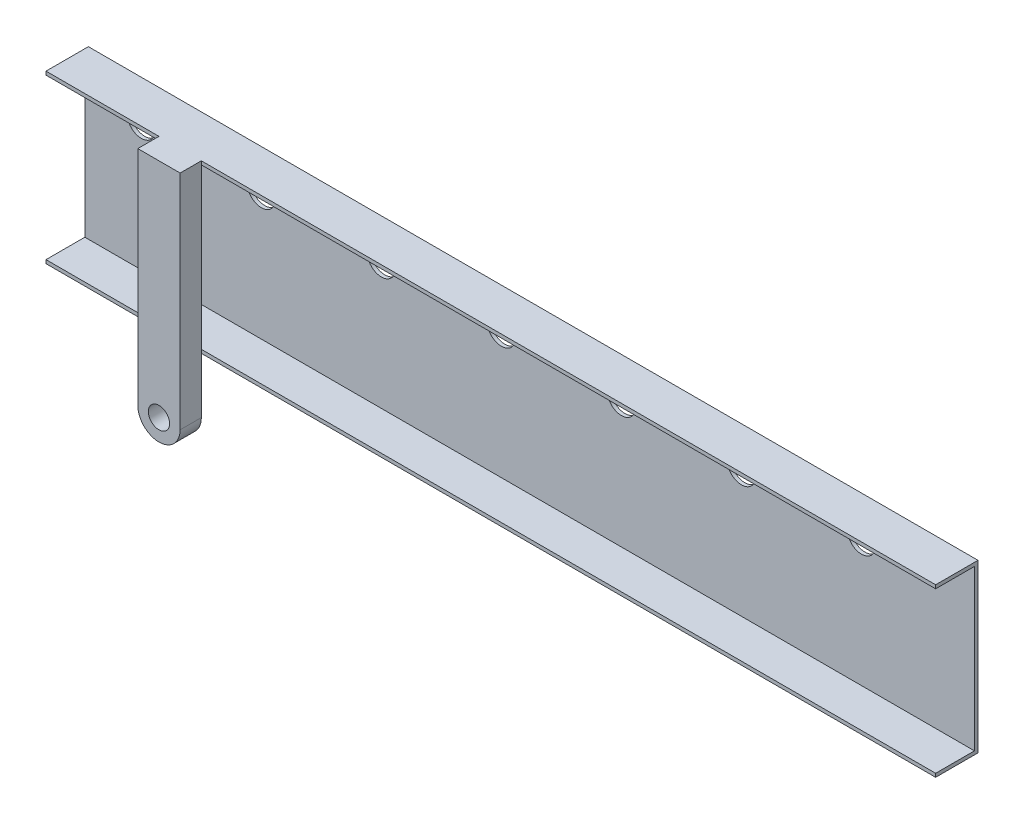
from build123d import *

# Parameters (mm, degrees)
BASE_EXTRUDE_THIN_DEPTH = 800.1
SKETCH2_R               = 12.7
CUT_EXTRUDE1_DEPTH      = 815.930438749
LPATTERN1_COUNT         = 7
LPATTERN1_PITCH         = 107.95
BOSS_EXTRUDE1_START     = 38.1
BOSS_EXTRUDE1_OUTLINE_R = 9.525
BOSS_EXTRUDE1_DEPTH     = 19.05


# Read off the part's stored shape, not the designer's step: Boss-Extrude1
with BuildPart() as part:
    # Sketch1 → Base-Extrude-Thin (new body)
    with BuildSketch(Plane(origin=(0, 0, 0), x_dir=(0, 0, -1), z_dir=(1, 0, 0))):
        Polygon((-38.1, 0), (0, 0), (0, -150), (-38.1, -150), (-38.1, -146.825), (-3.175, -146.825), (-3.175, -3.175), (-38.1, -3.175), align=None)
    extrude(amount=BASE_EXTRUDE_THIN_DEPTH)

    # Sketch2 → Cut-Extrude1 (cut, through all)
    with BuildSketch(Plane(origin=(0, 0, 0), x_dir=(-1, 0, 0), z_dir=(0, 0, -1))):
        with Locations(Location((-50.8, -31.75, 0), (0, 0, 90))):
            Circle(SKETCH2_R)
    cut_extrude1 = extrude(amount=-CUT_EXTRUDE1_DEPTH, mode=Mode.SUBTRACT)

    # LPattern1: Cut-Extrude1 ×7
    with Locations(*[(i * LPATTERN1_PITCH, 0, 0) for i in range(1, LPATTERN1_COUNT)]):
        add(cut_extrude1, mode=Mode.SUBTRACT)

    # Boss-Extrude1 outline → Boss-Extrude1 (add)
    with BuildSketch(Plane.XY.offset(BOSS_EXTRUDE1_START)):
        with BuildLine():
            Line((101.6, 0), (101.6, -200))
            ThreePointArc((101.6, -200), (120.65, -219.05), (139.7, -200))
            Line((139.7, -200), (139.7, 0))
            Line((139.7, 0), (101.6, 0))
        make_face()
        with Locations((120.65, -200)):
            Circle(BOSS_EXTRUDE1_OUTLINE_R, mode=Mode.SUBTRACT)
    extrude(amount=BOSS_EXTRUDE1_DEPTH)


solid = part.part
